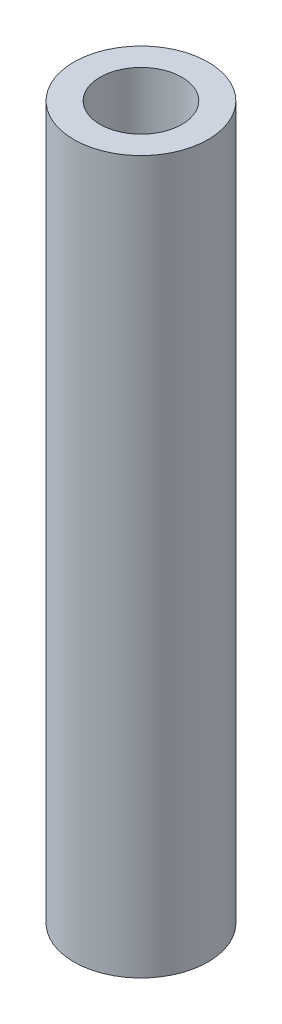
from build123d import *

# Parameters (mm, degrees)
SKETCH1_R               = 4.1
BOSS_EXTRUDE1_DEPTH     = 43.5
TAP_DRILL_FOR_M6_TAP1_D = 5


with BuildPart() as part:
    # Sketch1 → Boss-Extrude1 (new body)
    with BuildSketch(Plane(origin=(0, 0, 0), x_dir=(1, 0, 0), z_dir=(0, 1, 0))):
        with Locations((59.475545776, 35.570000001)):
            Circle(SKETCH1_R)
    extrude(amount=-BOSS_EXTRUDE1_DEPTH)

    # Tap Drill for M6 Tap1 (through all)
    with Locations(Plane(origin=(0, -43.5, 0), x_dir=(-1, 0, 0), z_dir=(0, -1, 0))):
        with Locations((-59.475545776, 35.570000001)):
            Hole(TAP_DRILL_FOR_M6_TAP1_D / 2)


solid = part.part
